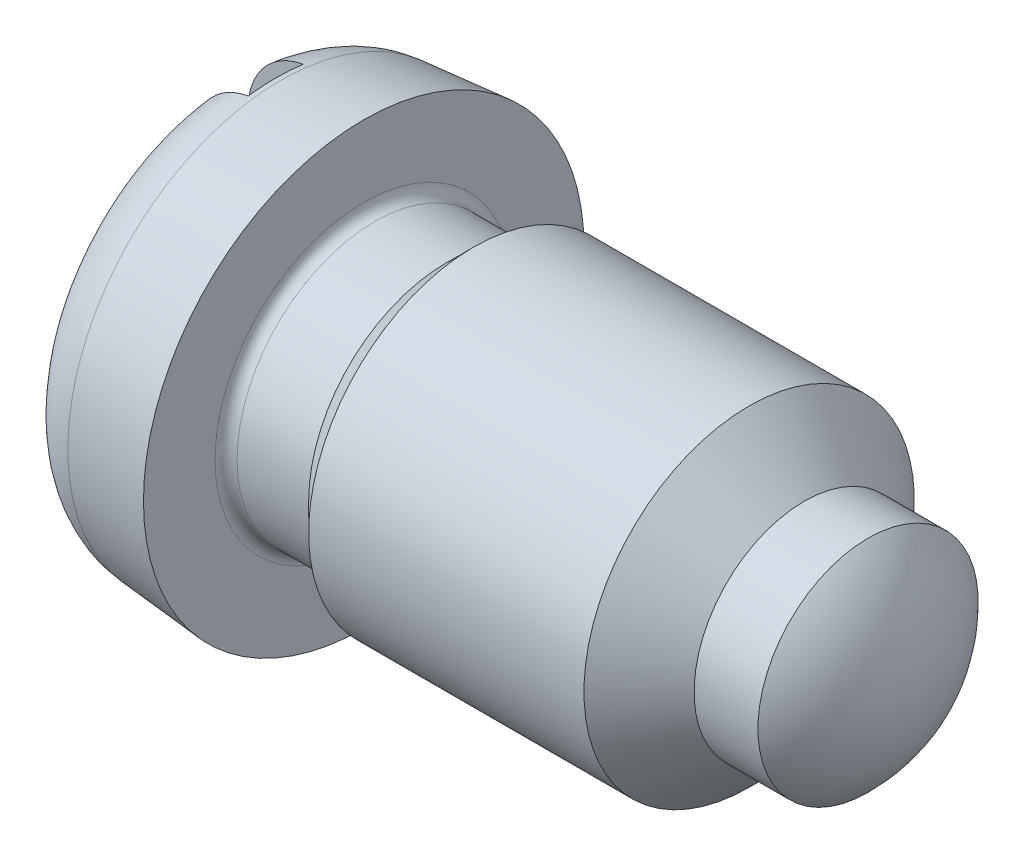
from build123d import *

# Parameters (mm, degrees)
FILLET1_R       = 0.6
FILLET2_R       = 0.1
SLOT_DEPTH      = 7.905794668
SLOT_DEPTH_BACK = 7.905794668
SKETCH2_W       = 0.5
SKETCH2_H       = 0.5


with BuildPart() as part:
    # Sketch1 → Base (revolve)
    with BuildSketch(Plane.XY):
        with BuildLine():
            Line((1.3, 1.5), (4.8, 1.5))
            Line((4.8, 1.5), (5.3, 1))
            Line((5.3, 1), (5.879795897, 1))
            ThreePointArc((5.879795897, 1), (6.190680878, 0.5423494), (6.3, 0))
            Line((6.3, 0), (0, 0))
            Line((0, 0), (0, 1.886264737))
            Line((0, 1.886264737), (1.3, 2))
            Line((1.3, 2), (1.3, 1.5))
        make_face()
    revolve(axis=Axis((1.3, 0, 0), (1, 0, 0)))

    # Fillet1
    fillet1_edges = [part.edges().sort_by_distance(p)[0] for p in [
        (0, -1.886264737, 0),
    ]]
    fillet(fillet1_edges, radius=FILLET1_R)

    # Sketch3 → Cut-Revolve1 (revolve, cut)
    with BuildSketch(Plane.XY):
        Polygon((1.3, 2), (1.3, 1.25), (2.05, 1.25), (2.3, 1.5), (2.3, 2), align=None)
    revolve(axis=Axis((0, 0, 0), (1, 0, 0)), mode=Mode.SUBTRACT)

    # Fillet2
    fillet2_edges = [part.edges().sort_by_distance(p)[0] for p in [
        (1.3, -1.25, 0),
    ]]
    fillet(fillet2_edges, radius=FILLET2_R)

    # Sketch2 → Slot (cut, two sides: drawn at the far end of the back side and taken through both)
    with BuildSketch(Plane(origin=(0, 0, 0), x_dir=(-1, 0, 0), z_dir=(0, -1, 0)).offset(-SLOT_DEPTH_BACK)):
        with Locations((-0.25, 0)):
            Rectangle(SKETCH2_W, SKETCH2_H)
    extrude(amount=SLOT_DEPTH + SLOT_DEPTH_BACK, mode=Mode.SUBTRACT)


solid = part.part
